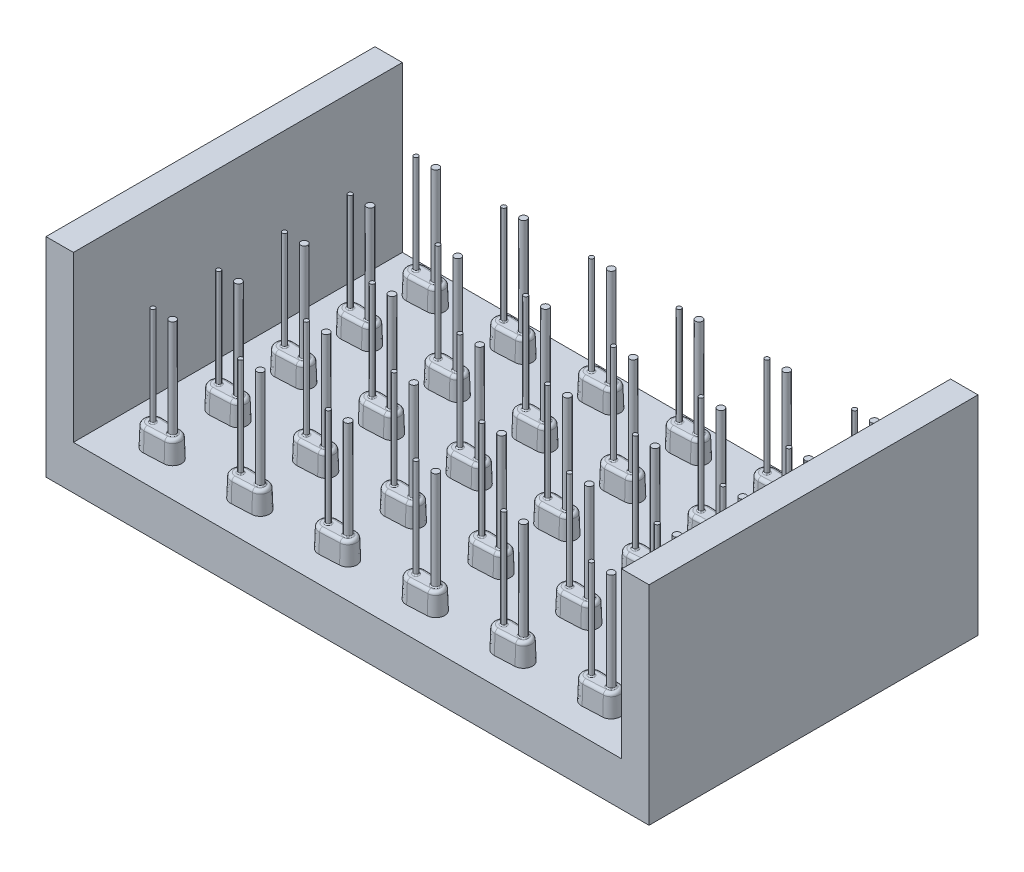
from build123d import *

# Parameters (mm, degrees)
SKETCH1_W                              = 55
SKETCH1_H                              = 30
BASE_DEPTH                             = 4
SKETCH2_W                              = 2.5
SKETCH2_H                              = 30
WALLS_DEPTH                            = 15
SCREW_POST_SKETCH_R                    = 0.2
SCREW_POST_DEPTH                       = 11
F_23_GA_POST_SLETCH_R                  = 0.315
F_23_GA_POST_DEPTH                     = 11
TOP_PIECE_PLASTIC_PART_DEPTH           = 2
TOP_PIECE_PLASTIC_PART_TAPER           = 2
TOP_PIECE_FILET_R                      = 0.3
POST_FILET_R                           = 0.1
TOP_PIECE_PATTERN_COUNT                = 5
TOP_PIECE_PATTERN_PITCH                = 6
TOP_PIECE_PATTERN_COUNT_DIR2           = 6
TOP_PIECE_PATTERN_PITCH_DIR2           = 8
TOP_PIECE_FILET_OF_TOP_PIECE_PATTERN_R = 0.3
POST_FILET_OF_TOP_PIECE_PATTERN_R      = 0.1
EXTRUDE1_DEPTH                         = 0.25


with BuildPart() as part:
    # Sketch1 → Base (new body)
    with BuildSketch(Plane(origin=(0, 0, 0), x_dir=(1, 0, 0), z_dir=(0, 1, 0))):
        Rectangle(SKETCH1_W, SKETCH1_H)
    extrude(amount=BASE_DEPTH)

    # Sketch2 → Walls (add)
    with BuildSketch(Plane(origin=(0, 4, 0), x_dir=(-1, 0, 0), z_dir=(0, 1, 0))):
        with Locations((26.25, 0)):
            Rectangle(SKETCH2_W, SKETCH2_H)
        with Locations((-26.25, 0)):
            Rectangle(SKETCH2_W, SKETCH2_H)
    extrude(amount=WALLS_DEPTH)

    # screw_post_sketch → screw_post (add)
    with BuildSketch(Plane(origin=(0, 4, 0), x_dir=(-1, 0, 0), z_dir=(0, 1, 0))):
        with Locations((21, 11.75)):
            Circle(SCREW_POST_SKETCH_R)
    screw_post = extrude(amount=SCREW_POST_DEPTH)

    # 23_Ga_post_sletch → 23_Ga_post (add)
    with BuildSketch(Plane(origin=(0, 4, 0), x_dir=(-1, 0, 0), z_dir=(0, 1, 0))):
        with Locations((19.2, 11.75)):
            Circle(F_23_GA_POST_SLETCH_R)
    f_23_ga_post = extrude(amount=F_23_GA_POST_DEPTH)

    # Sketch4 → Top_piece_plastic_part (add)
    with BuildSketch(Plane(origin=(0, 4, 0), x_dir=(-1, 0, 0), z_dir=(0, 1, 0))):
        with BuildLine():
            Line((20.9575, 12.648995968), (19.161513889, 12.564090793))
            ThreePointArc((19.161513889, 12.564090793), (18.385, 11.75), (19.161513889, 10.935909207))
            Line((19.161513889, 10.935909207), (20.9575, 10.851004032))
            ThreePointArc((20.9575, 10.851004032), (21.9, 11.75), (20.9575, 12.648995968))
        make_face()
    top_piece_plastic_part = extrude(amount=TOP_PIECE_PLASTIC_PART_DEPTH, taper=TOP_PIECE_PLASTIC_PART_TAPER)

    # Top_piece_filet
    top_piece_filet_edges = [part.edges().sort_by_distance(p)[0] for p in [
        (-18.454841539, 6, 11.75),
        (-20.062805017, 6, 10.963220244),
        (-21.830158461, 6, 11.75),
        (-20.062805017, 6, 12.536779756),
    ]]
    fillet(top_piece_filet_edges, radius=TOP_PIECE_FILET_R)

    # Post_filet
    post_filet_edges = [part.edges().sort_by_distance(p)[0] for p in [
        (-20.8, 6, 11.75),
        (-18.885, 6, 11.75),
    ]]
    fillet(post_filet_edges, radius=POST_FILET_R)

    # top_piece_pattern: screw_post, 23_Ga_post, Top_piece_plastic_part 5 × 6
    with Locations(*[(j * TOP_PIECE_PATTERN_PITCH_DIR2, 0, -i * TOP_PIECE_PATTERN_PITCH) for i in range(TOP_PIECE_PATTERN_COUNT) for j in range(TOP_PIECE_PATTERN_COUNT_DIR2) if (i, j) != (0, 0)]):
        add(screw_post)
        add(f_23_ga_post)
        add(top_piece_plastic_part)

    # Top_piece_filet of top_piece_pattern
    top_piece_filet_of_top_piece_pattern_edges = [part.edges().sort_by_distance(p)[0] for p in [
        (-10.454841539, 6, 11.75),
        (-12.062805017, 6, 10.963220244),
        (-13.830158461, 6, 11.75),
        (-12.062805017, 6, 12.536779756),
        (-2.454841539, 6, 11.75),
        (-4.062805017, 6, 10.963220244),
        (-5.830158461, 6, 11.75),
        (-4.062805017, 6, 12.536779756),
        (5.545158461, 6, 11.75),
        (3.937194983, 6, 10.963220244),
        (2.169841539, 6, 11.75),
        (3.937194983, 6, 12.536779756),
        (13.545158461, 6, 11.75),
        (11.937194983, 6, 10.963220244),
        (10.169841539, 6, 11.75),
        (11.937194983, 6, 12.536779756),
        (21.545158461, 6, 11.75),
        (19.937194983, 6, 10.963220244),
        (18.169841539, 6, 11.75),
        (19.937194983, 6, 12.536779756),
        (-18.454841539, 6, 5.75),
        (-20.062805017, 6, 4.963220244),
        (-21.830158461, 6, 5.75),
        (-20.062805017, 6, 6.536779756),
        (-10.454841539, 6, 5.75),
        (-12.062805017, 6, 4.963220244),
        (-13.830158461, 6, 5.75),
        (-12.062805017, 6, 6.536779756),
        (-2.454841539, 6, 5.75),
        (-4.062805017, 6, 4.963220244),
        (-5.830158461, 6, 5.75),
        (-4.062805017, 6, 6.536779756),
        (5.545158461, 6, 5.75),
        (3.937194983, 6, 4.963220244),
        (2.169841539, 6, 5.75),
        (3.937194983, 6, 6.536779756),
        (13.545158461, 6, 5.75),
        (11.937194983, 6, 4.963220244),
        (10.169841539, 6, 5.75),
        (11.937194983, 6, 6.536779756),
        (21.545158461, 6, 5.75),
        (19.937194983, 6, 4.963220244),
        (18.169841539, 6, 5.75),
        (19.937194983, 6, 6.536779756),
        (-18.454841539, 6, -0.25),
        (-20.062805017, 6, -1.036779756),
        (-21.830158461, 6, -0.25),
        (-20.062805017, 6, 0.536779756),
        (-10.454841539, 6, -0.25),
        (-12.062805017, 6, -1.036779756),
        (-13.830158461, 6, -0.25),
        (-12.062805017, 6, 0.536779756),
        (-2.454841539, 6, -0.25),
        (-4.062805017, 6, -1.036779756),
        (-5.830158461, 6, -0.25),
        (-4.062805017, 6, 0.536779756),
        (5.545158461, 6, -0.25),
        (3.937194983, 6, -1.036779756),
        (2.169841539, 6, -0.25),
        (3.937194983, 6, 0.536779756),
        (13.545158461, 6, -0.25),
        (11.937194983, 6, -1.036779756),
        (10.169841539, 6, -0.25),
        (11.937194983, 6, 0.536779756),
        (21.545158461, 6, -0.25),
        (19.937194983, 6, -1.036779756),
        (18.169841539, 6, -0.25),
        (19.937194983, 6, 0.536779756),
        (-18.454841539, 6, -6.25),
        (-20.062805017, 6, -7.036779756),
        (-21.830158461, 6, -6.25),
        (-20.062805017, 6, -5.463220244),
        (-10.454841539, 6, -6.25),
        (-12.062805017, 6, -7.036779756),
        (-13.830158461, 6, -6.25),
        (-12.062805017, 6, -5.463220244),
        (-2.454841539, 6, -6.25),
        (-4.062805017, 6, -7.036779756),
        (-5.830158461, 6, -6.25),
        (-4.062805017, 6, -5.463220244),
        (5.545158461, 6, -6.25),
        (3.937194983, 6, -7.036779756),
        (2.169841539, 6, -6.25),
        (3.937194983, 6, -5.463220244),
        (13.545158461, 6, -6.25),
        (11.937194983, 6, -7.036779756),
        (10.169841539, 6, -6.25),
        (11.937194983, 6, -5.463220244),
        (21.545158461, 6, -6.25),
        (19.937194983, 6, -7.036779756),
        (18.169841539, 6, -6.25),
        (19.937194983, 6, -5.463220244),
        (-18.454841539, 6, -12.25),
        (-20.062805017, 6, -13.036779756),
        (-21.830158461, 6, -12.25),
        (-20.062805017, 6, -11.463220244),
        (-10.454841539, 6, -12.25),
        (-12.062805017, 6, -13.036779756),
        (-13.830158461, 6, -12.25),
        (-12.062805017, 6, -11.463220244),
        (-2.454841539, 6, -12.25),
        (-4.062805017, 6, -13.036779756),
        (-5.830158461, 6, -12.25),
        (-4.062805017, 6, -11.463220244),
        (5.545158461, 6, -12.25),
        (3.937194983, 6, -13.036779756),
        (2.169841539, 6, -12.25),
        (3.937194983, 6, -11.463220244),
        (13.545158461, 6, -12.25),
        (11.937194983, 6, -13.036779756),
        (10.169841539, 6, -12.25),
        (11.937194983, 6, -11.463220244),
        (21.545158461, 6, -12.25),
        (19.937194983, 6, -13.036779756),
        (18.169841539, 6, -12.25),
        (19.937194983, 6, -11.463220244),
    ]]
    fillet(top_piece_filet_of_top_piece_pattern_edges, radius=TOP_PIECE_FILET_OF_TOP_PIECE_PATTERN_R)

    # Post_filet of top_piece_pattern
    post_filet_of_top_piece_pattern_edges = [part.edges().sort_by_distance(p)[0] for p in [
        (-12.8, 6, 11.75),
        (-10.885, 6, 11.75),
        (-4.8, 6, 11.75),
        (-2.885, 6, 11.75),
        (3.2, 6, 11.75),
        (5.115, 6, 11.75),
        (11.2, 6, 11.75),
        (13.115, 6, 11.75),
        (19.2, 6, 11.75),
        (21.115, 6, 11.75),
        (-20.8, 6, 5.75),
        (-18.885, 6, 5.75),
        (-12.8, 6, 5.75),
        (-10.885, 6, 5.75),
        (-4.8, 6, 5.75),
        (-2.885, 6, 5.75),
        (3.2, 6, 5.75),
        (5.115, 6, 5.75),
        (11.2, 6, 5.75),
        (13.115, 6, 5.75),
        (19.2, 6, 5.75),
        (21.115, 6, 5.75),
        (-20.8, 6, -0.25),
        (-18.885, 6, -0.25),
        (-12.8, 6, -0.25),
        (-10.885, 6, -0.25),
        (-4.8, 6, -0.25),
        (-2.885, 6, -0.25),
        (3.2, 6, -0.25),
        (5.115, 6, -0.25),
        (11.2, 6, -0.25),
        (13.115, 6, -0.25),
        (19.2, 6, -0.25),
        (21.115, 6, -0.25),
        (-20.8, 6, -6.25),
        (-18.885, 6, -6.25),
        (-12.8, 6, -6.25),
        (-10.885, 6, -6.25),
        (-4.8, 6, -6.25),
        (-2.885, 6, -6.25),
        (3.2, 6, -6.25),
        (5.115, 6, -6.25),
        (11.2, 6, -6.25),
        (13.115, 6, -6.25),
        (19.2, 6, -6.25),
        (21.115, 6, -6.25),
        (-20.8, 6, -12.25),
        (-18.885, 6, -12.25),
        (-12.8, 6, -12.25),
        (-10.885, 6, -12.25),
        (-4.8, 6, -12.25),
        (-2.885, 6, -12.25),
        (3.2, 6, -12.25),
        (5.115, 6, -12.25),
        (11.2, 6, -12.25),
        (13.115, 6, -12.25),
        (19.2, 6, -12.25),
        (21.115, 6, -12.25),
    ]]
    fillet(post_filet_of_top_piece_pattern_edges, radius=POST_FILET_OF_TOP_PIECE_PATTERN_R)

    # Sketch5 → Extrude1 (add)
    # profile 1 of 16: a face of its own
    with BuildSketch(Plane(origin=(0, 4, 0), x_dir=(-1, 0, 0), z_dir=(0, 1, 0))):
        Polygon((-22.960116624, -12.387319566), (-22.960116624, -12.117788316), (-23.665344989, -11.81850947), (-22.960116624, -11.487379663), (-22.960116624, -11.213641682), (-24.460116624, -11.918269086), (-24.460116624, -12.192007066), (-23.967027682, -11.960336393), align=None)
    # profile 2 of 16: a face of its own
    with BuildSketch(Plane(origin=(0, 4, 0), x_dir=(-1, 0, 0), z_dir=(0, 1, 0))):
        with BuildLine():
            Line((-22.960116624, -10.242487836), (-22.960116624, -9.973257066))
            Line((-22.960116624, -9.973257066), (-24.05627047, -9.973257066))
            Line((-24.05627047, -9.973257066), (-24.05627047, -10.242487836))
            Line((-24.05627047, -10.242487836), (-23.936679124, -10.242487836))
            add(Edge.make_bspline(
                [(-23.936679124, -10.242487836), (-23.94831865, -10.255828724), (-23.970908671, -10.281720752), (-24.000241938, -10.322508136), (-24.024310941, -10.363373505), (-24.04381057, -10.404501305), (-24.057816966, -10.446765525), (-24.068196379, -10.49026865), (-24.074251475, -10.535586778), (-24.075080312, -10.5663884), (-24.075501239, -10.582031105)],
                knots=[0, 0, 0, 0, 1.129160586, 2.191477711, 3.199794721, 4.151823543, 5.089502826, 6.035032201, 7.00208469, 8, 8, 8, 8], degree=3))
            add(Edge.make_bspline(
                [(-24.075501239, -10.582031105), (-24.075106168, -10.599591198), (-24.074325485, -10.634290938), (-24.066108369, -10.685209286), (-24.053528446, -10.734374725), (-24.035732838, -10.781753482), (-24.012649059, -10.827236261), (-23.985030533, -10.871192832), (-23.951455685, -10.912608296), (-23.914037143, -10.952379679), (-23.872589153, -10.988700322), (-23.828295021, -11.02089858), (-23.781128387, -11.04765544), (-23.731699603, -11.069649973), (-23.679889283, -11.086926094), (-23.625561279, -11.099247924), (-23.568688515, -11.106516265), (-23.529949309, -11.10741601), (-23.510296912, -11.107872451)],
                knots=[0, 0, 0, 0, 0.980545136, 1.937612761, 2.874348888, 3.813122963, 4.759326438, 5.720509799, 6.70829705, 7.733758992, 8.768951258, 9.783355028, 10.788637727, 11.793421666, 12.80232853, 13.835642703, 14.90202171, 16, 16, 16, 16], degree=3))
            add(Edge.make_bspline(
                [(-23.510296912, -11.107872451), (-23.489946717, -11.10739361), (-23.450027541, -11.10645431), (-23.391449532, -11.099578863), (-23.335768678, -11.087494299), (-23.282933948, -11.07097602), (-23.232797469, -11.049851918), (-23.185673571, -11.023597731), (-23.141139167, -10.992866982), (-23.100304214, -10.957356562), (-23.063025641, -10.919021801), (-23.030114863, -10.878257925), (-23.002842669, -10.835054132), (-22.979959939, -10.790095984), (-22.962612813, -10.742938288), (-22.949826664, -10.693864615), (-22.942173642, -10.642669744), (-22.941318682, -10.607798044), (-22.940885855, -10.590144086)],
                knots=[0, 0, 0, 0, 1.136421085, 2.229216585, 3.287981067, 4.314102594, 5.316702899, 6.320753391, 7.321604446, 8.333029371, 9.337827526, 10.304906535, 11.253050047, 12.186157492, 13.117149921, 14.053303955, 15.014476191, 16, 16, 16, 16], degree=3))
            add(Edge.make_bspline(
                [(-22.940885855, -10.590144086), (-22.941225602, -10.573790591), (-22.941897839, -10.54143292), (-22.949197051, -10.493871805), (-22.96023659, -10.447744384), (-22.975965946, -10.403302283), (-22.995827459, -10.360180974), (-23.020715414, -10.31912217), (-23.049583782, -10.279227673), (-23.07213059, -10.254885758), (-23.08361422, -10.242487836)],
                knots=[0, 0, 0, 0, 1.017011718, 2.012299608, 2.98747302, 3.965332399, 4.941441765, 5.936729654, 6.94912688, 8, 8, 8, 8], degree=3))
            Line((-23.08361422, -10.242487836), (-22.960116624, -10.242487836))
        make_face()
        with BuildLine():
            add(Edge.make_bspline(
                [(-23.190885855, -10.533653701), (-23.191215028, -10.544381754), (-23.191860187, -10.565408036), (-23.195740863, -10.596330062), (-23.202578787, -10.625882242), (-23.212680351, -10.653853813), (-23.224985528, -10.680661655), (-23.24039756, -10.705898685), (-23.258614254, -10.729773192), (-23.279194584, -10.752144769), (-23.30181613, -10.772539757), (-23.326501138, -10.790121428), (-23.352584487, -10.805063007), (-23.380144601, -10.8176997), (-23.409507601, -10.826744705), (-23.440291233, -10.833908345), (-23.472746984, -10.837625811), (-23.494864574, -10.83829967), (-23.506090182, -10.838641682)],
                knots=[0, 0, 0, 0, 1.04836806, 2.054732945, 3.03993516, 4.00574415, 4.955904794, 5.917688631, 6.888591924, 7.88601754, 8.884115178, 9.859153345, 10.841239365, 11.818093293, 12.814750328, 13.83810466, 14.90274714, 16, 16, 16, 16], degree=3))
            add(Edge.make_bspline(
                [(-23.506090182, -10.838641682), (-23.517417699, -10.838305046), (-23.53973844, -10.837641708), (-23.57246673, -10.833846525), (-23.603704507, -10.826948471), (-23.633172951, -10.81684486), (-23.661411438, -10.804623664), (-23.687885089, -10.789231272), (-23.712681695, -10.770907645), (-23.73602257, -10.750482703), (-23.756720113, -10.727654725), (-23.775551719, -10.703874807), (-23.790623933, -10.678210024), (-23.803504345, -10.651546419), (-23.813397142, -10.623641256), (-23.820337694, -10.594324665), (-23.824585019, -10.563826234), (-23.825193724, -10.542982146), (-23.825501239, -10.532451778)],
                knots=[0, 0, 0, 0, 1.099386164, 2.166327687, 3.192099357, 4.19717067, 5.185034887, 6.173616074, 7.161193358, 8.17338296, 9.177655011, 10.147763629, 11.111227589, 12.058972978, 13.018112925, 13.97759754, 14.978288615, 16, 16, 16, 16], degree=3))
            add(Edge.make_bspline(
                [(-23.825501239, -10.532451778), (-23.825170211, -10.521523912), (-23.824521214, -10.500099355), (-23.820676089, -10.468672719), (-23.813812602, -10.438724032), (-23.80365499, -10.410375031), (-23.791431551, -10.38320326), (-23.776345287, -10.357414898), (-23.7580319, -10.333378209), (-23.737612506, -10.310525608), (-23.714346288, -10.290341118), (-23.689778118, -10.272010191), (-23.663046638, -10.256985645), (-23.634737921, -10.244659567), (-23.604747023, -10.234999842), (-23.573070052, -10.228032166), (-23.539635189, -10.224250699), (-23.516816064, -10.223592465), (-23.505188739, -10.223257066)],
                knots=[0, 0, 0, 0, 1.049905731, 2.058385982, 3.036337956, 3.994927362, 4.946537361, 5.895419282, 6.857623746, 7.845325573, 8.833777008, 9.811444928, 10.78531754, 11.772081556, 12.77319045, 13.807459548, 14.882806445, 16, 16, 16, 16], degree=3))
            add(Edge.make_bspline(
                [(-23.505188739, -10.223257066), (-23.493761402, -10.223588297), (-23.471440494, -10.224235287), (-23.438703698, -10.228048541), (-23.407648905, -10.235065473), (-23.378180908, -10.244525929), (-23.350550528, -10.257065431), (-23.324458305, -10.272107621), (-23.300236965, -10.290239644), (-23.277563983, -10.310645787), (-23.257430739, -10.33336744), (-23.239356277, -10.35754778), (-23.224484206, -10.383462757), (-23.211887671, -10.410623094), (-23.202769683, -10.439464789), (-23.195684614, -10.469460851), (-23.191862901, -10.50110462), (-23.191216852, -10.522626953), (-23.190885855, -10.533653701)],
                knots=[0, 0, 0, 0, 1.106469885, 2.16125711, 3.184599668, 4.184238692, 5.152050012, 6.116650044, 7.094080022, 8.075733422, 9.064591803, 10.028460505, 10.993060537, 11.952039452, 12.921015874, 13.915988178, 14.932277727, 16, 16, 16, 16], degree=3))
        make_face(mode=Mode.SUBTRACT)
    # profile 3 of 16: a face of its own
    with BuildSketch(Plane(origin=(0, 4, 0), x_dir=(-1, 0, 0), z_dir=(0, 1, 0))):
        with BuildLine():
            Line((-22.960116624, -9.704026297), (-22.960116624, -9.434795528))
            Line((-22.960116624, -9.434795528), (-23.091126239, -9.434795528))
            add(Edge.make_bspline(
                [(-23.091126239, -9.434795528), (-23.07904385, -9.42281764), (-23.055254617, -9.399234163), (-23.024550491, -9.360131384), (-22.998567744, -9.319156486), (-22.977369016, -9.276255322), (-22.96107878, -9.23138539), (-22.949295895, -9.184593251), (-22.942292372, -9.135628077), (-22.941359891, -9.102286115), (-22.940885855, -9.085336393)],
                knots=[0, 0, 0, 0, 1.041604913, 2.050834463, 3.038316637, 4.009881179, 4.976705026, 5.957567047, 6.961708705, 8, 8, 8, 8], degree=3))
            add(Edge.make_bspline(
                [(-22.940885855, -9.085336393), (-22.941421192, -9.068365396), (-22.942474987, -9.034958536), (-22.952069763, -8.986204056), (-22.967801063, -8.939986821), (-22.989794807, -8.896724725), (-23.017596673, -8.856578171), (-23.051616624, -8.820800146), (-23.091084423, -8.78860082), (-23.120903733, -8.771428105), (-23.136198355, -8.762620047)],
                knots=[0, 0, 0, 0, 1.023911673, 2.015537006, 2.987151534, 3.96359182, 4.936711095, 5.925066441, 6.935745846, 8, 8, 8, 8], degree=3))
            add(Edge.make_bspline(
                [(-23.136198355, -8.762620047), (-23.120859283, -8.751276152), (-23.090752991, -8.729011268), (-23.051468271, -8.689531379), (-23.017366504, -8.646825887), (-22.989946338, -8.599959903), (-22.967701804, -8.550582716), (-22.952160372, -8.498551943), (-22.942482586, -8.44437239), (-22.94142252, -8.407492607), (-22.940885855, -8.38882197)],
                knots=[0, 0, 0, 0, 1.041229049, 2.043640428, 3.033525965, 4.020091993, 5.002641512, 5.986151007, 6.980475447, 8, 8, 8, 8], degree=3))
            add(Edge.make_bspline(
                [(-22.940885855, -8.38882197), (-22.941463069, -8.369641955), (-22.942592959, -8.332097334), (-22.953120108, -8.27772932), (-22.969926379, -8.226757779), (-22.99374217, -8.180248203), (-23.022360884, -8.138249874), (-23.056029293, -8.102494043), (-23.093716912, -8.072827769), (-23.128903336, -8.053509569), (-23.160013135, -8.041021224), (-23.18708434, -8.033480597), (-23.217312811, -8.026427796), (-23.251104804, -8.021361059), (-23.288142719, -8.016631486), (-23.32867279, -8.013885783), (-23.372558484, -8.0120195), (-23.402922756, -8.011821277), (-23.418650278, -8.011718605)],
                knots=[0, 0, 0, 0, 1.315170088, 2.574427765, 3.785264002, 4.987326231, 6.148597475, 7.262257941, 8.344498924, 9.427503778, 10.004496072, 10.641882744, 11.353963707, 12.133766957, 12.985572148, 13.916147416, 14.920644765, 16, 16, 16, 16], degree=3))
            Line((-23.418650278, -8.011718605), (-24.05627047, -8.011718605))
            Line((-24.05627047, -8.011718605), (-24.05627047, -8.280949374))
            Line((-24.05627047, -8.280949374), (-23.505789701, -8.280949374))
            add(Edge.make_bspline(
                [(-23.505789701, -8.280949374), (-23.49106532, -8.281173361), (-23.462803202, -8.281603282), (-23.422267277, -8.283433111), (-23.385502302, -8.287522005), (-23.352315011, -8.292333185), (-23.322848053, -8.299155303), (-23.297175004, -8.307650519), (-23.274883723, -8.31691018), (-23.256469355, -8.328714723), (-23.240877802, -8.341820338), (-23.227546585, -8.356443092), (-23.216037199, -8.372411336), (-23.206592258, -8.389937908), (-23.199733005, -8.409242258), (-23.194772176, -8.429897265), (-23.191190277, -8.452001502), (-23.190989197, -8.467232287), (-23.190885855, -8.475059951)],
                knots=[0, 0, 0, 0, 1.668542725, 3.202616995, 4.59494355, 5.858072538, 7.000420988, 8.016011705, 8.920533432, 9.726500161, 10.483524044, 11.222469706, 11.962547318, 12.70886311, 13.469958868, 14.276404817, 15.114180646, 16, 16, 16, 16], degree=3))
            add(Edge.make_bspline(
                [(-23.190885855, -8.475059951), (-23.191302813, -8.487120327), (-23.192121011, -8.510786414), (-23.199939809, -8.545272726), (-23.212722706, -8.5777246), (-23.230112706, -8.608020457), (-23.251832488, -8.635508399), (-23.277594219, -8.65955339), (-23.307546368, -8.679411198), (-23.335335955, -8.693157258), (-23.360463325, -8.701746818), (-23.381982899, -8.707805973), (-23.406318355, -8.712528842), (-23.43322323, -8.716225467), (-23.46284962, -8.719771946), (-23.495160062, -8.721511829), (-23.530109668, -8.72329226), (-23.554264343, -8.723269083), (-23.566787297, -8.723257066)],
                knots=[0, 0, 0, 0, 1.129913425, 2.217230253, 3.297175357, 4.391411011, 5.481605898, 6.571841268, 7.681894157, 8.841607612, 9.468549532, 10.170608623, 10.93710061, 11.791434153, 12.717934886, 13.734733707, 14.825576123, 16, 16, 16, 16], degree=3))
            Line((-23.566787297, -8.723257066), (-24.05627047, -8.723257066))
            Line((-24.05627047, -8.723257066), (-24.05627047, -8.992487836))
            Line((-24.05627047, -8.992487836), (-23.530729605, -8.992487836))
            add(Edge.make_bspline(
                [(-23.530729605, -8.992487836), (-23.519008403, -8.992495439), (-23.496460607, -8.992510066), (-23.463921869, -8.994015816), (-23.433813836, -8.995073521), (-23.406212929, -8.998135962), (-23.380989871, -9.000798426), (-23.358359122, -9.00482941), (-23.338263085, -9.009192378), (-23.31522668, -9.015909117), (-23.289821492, -9.026289994), (-23.263192372, -9.042004826), (-23.240374891, -9.060129737), (-23.222053054, -9.081469809), (-23.208251267, -9.105669715), (-23.197767935, -9.131890176), (-23.192177093, -9.160725884), (-23.19132535, -9.180567136), (-23.190885855, -9.190805143)],
                knots=[0, 0, 0, 0, 1.256080007, 2.416291064, 3.491165587, 4.483530984, 5.391666676, 6.208822394, 6.945895165, 7.594739348, 8.778939682, 9.876256816, 10.898991119, 11.88874005, 12.870128133, 13.872891123, 14.902420331, 16, 16, 16, 16], degree=3))
            add(Edge.make_bspline(
                [(-23.190885855, -9.190805143), (-23.19128221, -9.202372382), (-23.192067195, -9.225281394), (-23.20034351, -9.258588343), (-23.213044752, -9.290331127), (-23.230805006, -9.320036488), (-23.253176753, -9.347059455), (-23.279361761, -9.371235606), (-23.310377615, -9.390645498), (-23.338939968, -9.404235175), (-23.364478426, -9.41340553), (-23.386777151, -9.418908099), (-23.41148948, -9.424143793), (-23.43894062, -9.427729964), (-23.468857719, -9.431319184), (-23.501470968, -9.433046874), (-23.536720223, -9.434831254), (-23.561075203, -9.434807723), (-23.573698355, -9.434795528)],
                knots=[0, 0, 0, 0, 1.079272053, 2.137507324, 3.187593888, 4.26658165, 5.357445865, 6.457671147, 7.582166706, 8.763159278, 9.408686215, 10.114907681, 10.908114626, 11.768737996, 12.701314335, 13.723912485, 14.820306998, 16, 16, 16, 16], degree=3))
            Line((-23.573698355, -9.434795528), (-24.05627047, -9.434795528))
            Line((-24.05627047, -9.434795528), (-24.05627047, -9.704026297))
            Line((-24.05627047, -9.704026297), (-22.960116624, -9.704026297))
        make_face()
    # profile 4 of 16: a face of its own
    with BuildSketch(Plane(origin=(0, 4, 0), x_dir=(-1, 0, 0), z_dir=(0, 1, 0))):
        with BuildLine():
            Line((-22.960116624, -6.915564759), (-22.960116624, -6.646333989))
            Line((-22.960116624, -6.646333989), (-24.05627047, -6.646333989))
            Line((-24.05627047, -6.646333989), (-24.05627047, -6.915564759))
            Line((-24.05627047, -6.915564759), (-23.936679124, -6.915564759))
            add(Edge.make_bspline(
                [(-23.936679124, -6.915564759), (-23.94831865, -6.928905647), (-23.970908671, -6.954797676), (-24.000241938, -6.995585059), (-24.024310941, -7.036450428), (-24.04381057, -7.077578228), (-24.057816966, -7.119842448), (-24.068196379, -7.163345573), (-24.074251475, -7.208663701), (-24.075080312, -7.239465323), (-24.075501239, -7.255108028)],
                knots=[0, 0, 0, 0, 1.129160586, 2.191477711, 3.199794721, 4.151823543, 5.089502826, 6.035032201, 7.00208469, 8, 8, 8, 8], degree=3))
            add(Edge.make_bspline(
                [(-24.075501239, -7.255108028), (-24.075106168, -7.272668121), (-24.074325485, -7.307367862), (-24.066108369, -7.358286209), (-24.053528446, -7.407451648), (-24.035732838, -7.454830405), (-24.012649059, -7.500313184), (-23.985030533, -7.544269755), (-23.951455685, -7.585685219), (-23.914037143, -7.625456602), (-23.872589153, -7.661777245), (-23.828295021, -7.693975503), (-23.781128387, -7.720732363), (-23.731699603, -7.742726896), (-23.679889283, -7.760003017), (-23.625561279, -7.772324847), (-23.568688515, -7.779593189), (-23.529949309, -7.780492934), (-23.510296912, -7.780949374)],
                knots=[0, 0, 0, 0, 0.980545136, 1.937612761, 2.874348888, 3.813122963, 4.759326438, 5.720509799, 6.70829705, 7.733758992, 8.768951258, 9.783355028, 10.788637727, 11.793421666, 12.80232853, 13.835642703, 14.90202171, 16, 16, 16, 16], degree=3))
            add(Edge.make_bspline(
                [(-23.510296912, -7.780949374), (-23.489946717, -7.780470533), (-23.450027541, -7.779531233), (-23.391449532, -7.772655786), (-23.335768678, -7.760571222), (-23.282933948, -7.744052943), (-23.232797469, -7.722928841), (-23.185673571, -7.696674654), (-23.141139167, -7.665943905), (-23.100304214, -7.630433485), (-23.063025641, -7.592098724), (-23.030114863, -7.551334848), (-23.002842669, -7.508131055), (-22.979959939, -7.463172907), (-22.962612813, -7.416015211), (-22.949826664, -7.366941538), (-22.942173642, -7.315746667), (-22.941318682, -7.280874967), (-22.940885855, -7.263221009)],
                knots=[0, 0, 0, 0, 1.136421085, 2.229216585, 3.287981067, 4.314102594, 5.316702899, 6.320753391, 7.321604446, 8.333029371, 9.337827526, 10.304906535, 11.253050047, 12.186157492, 13.117149921, 14.053303955, 15.014476191, 16, 16, 16, 16], degree=3))
            add(Edge.make_bspline(
                [(-22.940885855, -7.263221009), (-22.941225602, -7.246867514), (-22.941897839, -7.214509843), (-22.949197051, -7.166948728), (-22.96023659, -7.120821307), (-22.975965946, -7.076379206), (-22.995827459, -7.033257897), (-23.020715414, -6.992199093), (-23.049583782, -6.952304596), (-23.07213059, -6.927962681), (-23.08361422, -6.915564759)],
                knots=[0, 0, 0, 0, 1.017011718, 2.012299608, 2.98747302, 3.965332399, 4.941441765, 5.936729654, 6.94912688, 8, 8, 8, 8], degree=3))
            Line((-23.08361422, -6.915564759), (-22.960116624, -6.915564759))
        make_face()
        with BuildLine():
            add(Edge.make_bspline(
                [(-23.190885855, -7.206730624), (-23.191215028, -7.217458677), (-23.191860187, -7.238484959), (-23.195740863, -7.269406985), (-23.202578787, -7.298959165), (-23.212680351, -7.326930737), (-23.224985528, -7.353738578), (-23.24039756, -7.378975608), (-23.258614254, -7.402850115), (-23.279194584, -7.425221692), (-23.30181613, -7.44561668), (-23.326501138, -7.463198351), (-23.352584487, -7.47813993), (-23.380144601, -7.490776623), (-23.409507601, -7.499821628), (-23.440291233, -7.506985268), (-23.472746984, -7.510702734), (-23.494864574, -7.511376593), (-23.506090182, -7.511718605)],
                knots=[0, 0, 0, 0, 1.04836806, 2.054732945, 3.03993516, 4.00574415, 4.955904794, 5.917688631, 6.888591924, 7.88601754, 8.884115178, 9.859153345, 10.841239365, 11.818093293, 12.814750328, 13.83810466, 14.90274714, 16, 16, 16, 16], degree=3))
            add(Edge.make_bspline(
                [(-23.506090182, -7.511718605), (-23.517417699, -7.511381969), (-23.53973844, -7.510718631), (-23.57246673, -7.506923448), (-23.603704507, -7.500025394), (-23.633172951, -7.489921783), (-23.661411438, -7.477700587), (-23.687885089, -7.462308195), (-23.712681695, -7.443984568), (-23.73602257, -7.423559626), (-23.756720113, -7.400731648), (-23.775551719, -7.37695173), (-23.790623933, -7.351286947), (-23.803504345, -7.324623342), (-23.813397142, -7.296718179), (-23.820337694, -7.267401588), (-23.824585019, -7.236903157), (-23.825193724, -7.216059069), (-23.825501239, -7.205528701)],
                knots=[0, 0, 0, 0, 1.099386164, 2.166327687, 3.192099357, 4.19717067, 5.185034887, 6.173616074, 7.161193358, 8.17338296, 9.177655011, 10.147763629, 11.111227589, 12.058972978, 13.018112925, 13.97759754, 14.978288615, 16, 16, 16, 16], degree=3))
            add(Edge.make_bspline(
                [(-23.825501239, -7.205528701), (-23.825170211, -7.194600835), (-23.824521214, -7.173176278), (-23.820676089, -7.141749642), (-23.813812602, -7.111800955), (-23.80365499, -7.083451954), (-23.791431551, -7.056280183), (-23.776345287, -7.030491821), (-23.7580319, -7.006455132), (-23.737612506, -6.983602531), (-23.714346288, -6.963418041), (-23.689778118, -6.945087114), (-23.663046638, -6.930062568), (-23.634737921, -6.91773649), (-23.604747023, -6.908076765), (-23.573070052, -6.901109089), (-23.539635189, -6.897327622), (-23.516816064, -6.896669388), (-23.505188739, -6.896333989)],
                knots=[0, 0, 0, 0, 1.049905731, 2.058385982, 3.036337956, 3.994927362, 4.946537361, 5.895419282, 6.857623746, 7.845325573, 8.833777008, 9.811444928, 10.78531754, 11.772081556, 12.77319045, 13.807459548, 14.882806445, 16, 16, 16, 16], degree=3))
            add(Edge.make_bspline(
                [(-23.505188739, -6.896333989), (-23.493761402, -6.89666522), (-23.471440494, -6.89731221), (-23.438703698, -6.901125465), (-23.407648905, -6.908142396), (-23.378180908, -6.917602852), (-23.350550528, -6.930142354), (-23.324458305, -6.945184544), (-23.300236965, -6.963316567), (-23.277563983, -6.98372271), (-23.257430739, -7.006444363), (-23.239356277, -7.030624703), (-23.224484206, -7.05653968), (-23.211887671, -7.083700017), (-23.202769683, -7.112541712), (-23.195684614, -7.142537774), (-23.191862901, -7.174181543), (-23.191216852, -7.195703876), (-23.190885855, -7.206730624)],
                knots=[0, 0, 0, 0, 1.106469885, 2.16125711, 3.184599668, 4.184238692, 5.152050012, 6.116650044, 7.094080022, 8.075733422, 9.064591803, 10.028460505, 10.993060537, 11.952039452, 12.921015874, 13.915988178, 14.932277727, 16, 16, 16, 16], degree=3))
        make_face(mode=Mode.SUBTRACT)
    # profile 5 of 16: a face of its own
    with BuildSketch(Plane(origin=(0, 4, 0), x_dir=(-1, 0, 0), z_dir=(0, 1, 0))):
        with BuildLine():
            add(Edge.make_bspline(
                [(-22.498578162, -6.243990239), (-22.499178509, -6.232296137), (-22.500355774, -6.209364292), (-22.510782969, -6.176322062), (-22.527894383, -6.146140702), (-22.551448541, -6.119647708), (-22.579361001, -6.097492466), (-22.610967384, -6.081213442), (-22.645520931, -6.071259853), (-22.669585724, -6.070035816), (-22.681871432, -6.069410913)],
                knots=[0, 0, 0, 0, 0.995917091, 1.952968814, 2.925129525, 3.936622411, 4.959141538, 5.949209871, 6.953017853, 8, 8, 8, 8], degree=3))
            add(Edge.make_bspline(
                [(-22.681871432, -6.069410913), (-22.693945244, -6.070078947), (-22.717662821, -6.071391222), (-22.751958917, -6.080799929), (-22.783118308, -6.097345714), (-22.811197037, -6.119002445), (-22.834421476, -6.145338114), (-22.851404386, -6.174977218), (-22.862246592, -6.207093692), (-22.863385347, -6.22958217), (-22.863962778, -6.240985432)],
                knots=[0, 0, 0, 0, 1.043811526, 2.050444424, 3.046135335, 4.077072307, 5.102170297, 6.060538231, 7.01655453, 8, 8, 8, 8], degree=3))
            add(Edge.make_bspline(
                [(-22.863962778, -6.240985432), (-22.863388372, -6.252686205), (-22.862260504, -6.275661136), (-22.851424259, -6.308682307), (-22.83402028, -6.338834813), (-22.810168705, -6.365468978), (-22.781553282, -6.387407042), (-22.749671302, -6.404165966), (-22.714452168, -6.413633267), (-22.690139202, -6.414909797), (-22.677664701, -6.415564759)],
                knots=[0, 0, 0, 0, 0.987521098, 1.939036667, 2.90720245, 3.915774129, 4.943044906, 5.943716191, 6.944961543, 8, 8, 8, 8], degree=3))
            add(Edge.make_bspline(
                [(-22.677664701, -6.415564759), (-22.665672408, -6.415072964), (-22.64217581, -6.414109388), (-22.608609992, -6.403982044), (-22.577763759, -6.388041406), (-22.550658739, -6.366123755), (-22.527202703, -6.340464192), (-22.510913269, -6.310601692), (-22.500283741, -6.278254235), (-22.499155791, -6.255594428), (-22.498578162, -6.243990239)],
                knots=[0, 0, 0, 0, 1.041915136, 2.041432787, 3.024826891, 4.049503271, 5.063162711, 6.031776888, 6.992064092, 8, 8, 8, 8], degree=3))
        make_face()
    # profile 6 of 16: a face of its own
    with BuildSketch(Plane(origin=(0, 4, 0), x_dir=(-1, 0, 0), z_dir=(0, 1, 0))):
        with BuildLine():
            Line((-22.960116624, -6.37710322), (-22.960116624, -6.107872451))
            Line((-22.960116624, -6.107872451), (-24.088121432, -6.107872451))
            add(Edge.make_bspline(
                [(-24.088121432, -6.107872451), (-24.100641581, -6.108040392), (-24.124885937, -6.108365597), (-24.160073908, -6.109366313), (-24.19283671, -6.111854299), (-24.223118657, -6.115053624), (-24.250985909, -6.119293485), (-24.276389164, -6.124267683), (-24.299379982, -6.13027029), (-24.326300633, -6.139279174), (-24.35649209, -6.153572132), (-24.388447931, -6.17548824), (-24.41614233, -6.201551834), (-24.43928021, -6.231963754), (-24.457174022, -6.266379195), (-24.470341004, -6.3041913), (-24.477725554, -6.345366885), (-24.478796744, -6.373869566), (-24.479347393, -6.388521489)],
                knots=[0, 0, 0, 0, 1.087870751, 2.106582289, 3.057635424, 3.94171963, 4.751506351, 5.505811896, 6.189668978, 6.814326215, 7.970363273, 9.078235859, 10.167775872, 11.260750684, 12.381770831, 13.52383714, 14.727117991, 16, 16, 16, 16], degree=3))
            add(Edge.make_bspline(
                [(-24.479347393, -6.388521489), (-24.478740146, -6.402773352), (-24.477445303, -6.433162854), (-24.469001919, -6.480873679), (-24.45607648, -6.533517594), (-24.443971871, -6.569593428), (-24.437580566, -6.588641682)],
                knots=[0, 0, 0, 0, 0.833128526, 1.776494837, 2.825976084, 4, 4, 4, 4], degree=3))
            Line((-24.437580566, -6.588641682), (-24.217628643, -6.588641682))
            add(Edge.make_bspline(
                [(-24.217628643, -6.588641682), (-24.222357719, -6.578613152), (-24.231374209, -6.559492685), (-24.240795137, -6.530822164), (-24.247583482, -6.504121944), (-24.24825568, -6.486715745), (-24.248578162, -6.478365239)],
                knots=[0, 0, 0, 0, 1.150954616, 2.194418511, 3.133784617, 4, 4, 4, 4], degree=3))
            add(Edge.make_bspline(
                [(-24.248578162, -6.478365239), (-24.248342145, -6.470402883), (-24.247894976, -6.455317076), (-24.241586068, -6.434345311), (-24.231874273, -6.416330772), (-24.217781284, -6.401121701), (-24.197908858, -6.389661951), (-24.171982752, -6.382391993), (-24.139976314, -6.377673393), (-24.116487968, -6.377303742), (-24.103746432, -6.37710322)],
                knots=[0, 0, 0, 0, 0.936804389, 1.774907915, 2.5581683, 3.336145098, 4.189867573, 5.229593264, 6.497159496, 8, 8, 8, 8], degree=3))
            Line((-24.103746432, -6.37710322), (-22.960116624, -6.37710322))
        make_face()
    # profile 7 of 16: a face of its own
    with BuildSketch(Plane(origin=(0, 4, 0), x_dir=(-1, 0, 0), z_dir=(0, 1, 0))):
        with BuildLine():
            Line((-22.960116624, -5.838641682), (-22.960116624, -5.569410913))
            Line((-22.960116624, -5.569410913), (-23.486258451, -5.569410913))
            add(Edge.make_bspline(
                [(-23.486258451, -5.569410913), (-23.498579422, -5.569387005), (-23.522226376, -5.56934112), (-23.55618803, -5.568064291), (-23.587244409, -5.566272648), (-23.615432127, -5.564036795), (-23.640683409, -5.560699659), (-23.662949962, -5.55684702), (-23.682392498, -5.552479543), (-23.704062975, -5.54537676), (-23.727782053, -5.534268444), (-23.752941747, -5.517474933), (-23.774830213, -5.497142322), (-23.793193161, -5.473289037), (-23.80784828, -5.44623946), (-23.817868198, -5.416121628), (-23.824465824, -5.383197125), (-23.825147005, -5.360210701), (-23.825501239, -5.348257066)],
                knots=[0, 0, 0, 0, 1.267467482, 2.432579623, 3.495718977, 4.46782216, 5.340771086, 6.114964255, 6.792308577, 7.388622481, 8.458084915, 9.475498183, 10.488937983, 11.51740562, 12.559360757, 13.637967653, 14.771671862, 16, 16, 16, 16], degree=3))
            add(Edge.make_bspline(
                [(-23.825501239, -5.348257066), (-23.8251007, -5.336313113), (-23.8243278, -5.313265456), (-23.818300519, -5.280040465), (-23.807972571, -5.249721714), (-23.793963929, -5.221997807), (-23.775215748, -5.197686326), (-23.75287596, -5.176519314), (-23.726584197, -5.158697187), (-23.706971295, -5.150132833), (-23.69689547, -5.145733028)],
                knots=[0, 0, 0, 0, 1.116871431, 2.155171802, 3.144773418, 4.104381479, 5.046960687, 6.001340237, 6.973219418, 8, 8, 8, 8], degree=3))
            add(Edge.make_bspline(
                [(-23.69689547, -5.145733028), (-23.692419837, -5.144117095), (-23.682540392, -5.14055011), (-23.665493629, -5.137405742), (-23.645417629, -5.133858157), (-23.621789922, -5.131788344), (-23.594962142, -5.129575095), (-23.564696004, -5.128154244), (-23.53113606, -5.12725293), (-23.507593328, -5.127154652), (-23.495272874, -5.12710322)],
                knots=[0, 0, 0, 0, 0.56097549, 1.238288705, 2.041265676, 2.968564175, 4.036154886, 5.220272437, 6.545304513, 8, 8, 8, 8], degree=3))
            Line((-23.495272874, -5.12710322), (-22.960116624, -5.12710322))
            Line((-22.960116624, -5.12710322), (-22.960116624, -4.857872451))
            Line((-22.960116624, -4.857872451), (-23.420753643, -4.857872451))
            add(Edge.make_bspline(
                [(-23.420753643, -4.857872451), (-23.443593526, -4.857914183), (-23.487384494, -4.857994195), (-23.550192945, -4.860619635), (-23.607336726, -4.863944603), (-23.658825217, -4.869174332), (-23.704944381, -4.875104214), (-23.745319233, -4.883295551), (-23.780364519, -4.892174065), (-23.801126271, -4.900347122), (-23.810777682, -4.904146489)],
                knots=[0, 0, 0, 0, 1.388116509, 2.661439483, 3.820463473, 4.866642689, 5.806839029, 6.644994921, 7.370105668, 8, 8, 8, 8], degree=3))
            add(Edge.make_bspline(
                [(-23.810777682, -4.904146489), (-23.821166255, -4.909013784), (-23.841672405, -4.918621405), (-23.87081992, -4.935300909), (-23.898464716, -4.953249634), (-23.923762601, -4.973430958), (-23.947602759, -4.994966162), (-23.969421594, -5.018281025), (-23.989258204, -5.043404104), (-24.007597431, -5.069908294), (-24.02324819, -5.098580813), (-24.037716634, -5.128688174), (-24.049233826, -5.16098488), (-24.058887326, -5.195012575), (-24.066368602, -5.230962248), (-24.071787373, -5.268688867), (-24.074689027, -5.308348034), (-24.075226066, -5.335332124), (-24.075501239, -5.349158509)],
                knots=[0, 0, 0, 0, 0.997222436, 1.96843142, 2.917797601, 3.860467999, 4.779133207, 5.709613475, 6.633219993, 7.560883278, 8.508369802, 9.470751391, 10.462672762, 11.485580885, 12.544670258, 13.653244457, 14.797545346, 16, 16, 16, 16], degree=3))
            add(Edge.make_bspline(
                [(-24.075501239, -5.349158509), (-24.075323242, -5.36409444), (-24.074974963, -5.393318993), (-24.070709903, -5.436015656), (-24.06519147, -5.47670615), (-24.055809123, -5.514936169), (-24.044939205, -5.551239611), (-24.031066297, -5.585199693), (-24.014755689, -5.616955184), (-23.996104078, -5.646568569), (-23.974940543, -5.673810175), (-23.952179897, -5.69928575), (-23.926916567, -5.722172834), (-23.899930694, -5.743218597), (-23.870973915, -5.762188156), (-23.84014919, -5.779090926), (-23.807316314, -5.793941225), (-23.784305156, -5.801864597), (-23.772616624, -5.805889278)],
                knots=[0, 0, 0, 0, 1.211240017, 2.369985978, 3.478996442, 4.539426614, 5.559871561, 6.551301256, 7.510778031, 8.453136967, 9.386094087, 10.30661716, 11.221130616, 12.147659962, 13.080758632, 14.026335491, 14.997475882, 16, 16, 16, 16], degree=3))
            add(Edge.make_bspline(
                [(-23.772616624, -5.805889278), (-23.763538862, -5.808635047), (-23.743983248, -5.814550073), (-23.7114841, -5.820936489), (-23.674027011, -5.826044577), (-23.631575139, -5.831013563), (-23.584057312, -5.834480019), (-23.531548994, -5.836745735), (-23.473947507, -5.83827661), (-23.433875697, -5.838516406), (-23.412941143, -5.838641682)],
                knots=[0, 0, 0, 0, 0.627914866, 1.352675004, 2.190563461, 3.132055958, 4.183353232, 5.345633452, 6.613289997, 8, 8, 8, 8], degree=3))
            Line((-23.412941143, -5.838641682), (-22.960116624, -5.838641682))
        make_face()
    # profile 8 of 16: a face of its own
    with BuildSketch(Plane(origin=(0, 4, 0), x_dir=(-1, 0, 0), z_dir=(0, 1, 0))):
        with BuildLine():
            Line((-22.960116624, -4.588641682), (-22.960116624, -4.319410913))
            Line((-22.960116624, -4.319410913), (-23.076102201, -4.319410913))
            add(Edge.make_bspline(
                [(-23.076102201, -4.319410913), (-23.064155279, -4.304051431), (-23.04132239, -4.274696475), (-23.01221034, -4.230071874), (-22.988383296, -4.187951775), (-22.970259227, -4.147397277), (-22.957219739, -4.107645346), (-22.947851645, -4.06805217), (-22.941852996, -4.028028127), (-22.941208062, -4.001122255), (-22.940885855, -3.987680143)],
                knots=[0, 0, 0, 0, 1.276643801, 2.439914479, 3.493451431, 4.44993799, 5.350072675, 6.235028322, 7.118224225, 8, 8, 8, 8], degree=3))
            add(Edge.make_bspline(
                [(-22.940885855, -3.987680143), (-22.941254071, -3.97404493), (-22.941976911, -3.947277861), (-22.947032591, -3.907864827), (-22.956240584, -3.870209501), (-22.96846631, -3.833888479), (-22.984603566, -3.799271447), (-23.00376394, -3.765934327), (-23.027102572, -3.734593186), (-23.044876153, -3.715291924), (-23.053866624, -3.705528701)],
                knots=[0, 0, 0, 0, 1.048836932, 2.058954983, 3.049370783, 4.026390553, 5.001981509, 5.982488534, 6.97947532, 8, 8, 8, 8], degree=3))
            add(Edge.make_bspline(
                [(-23.053866624, -3.705528701), (-23.062198162, -3.697698237), (-23.078922214, -3.681979999), (-23.10754135, -3.662200571), (-23.138741448, -3.645227597), (-23.172882409, -3.631320604), (-23.210151817, -3.621043896), (-23.25009951, -3.613137884), (-23.292949165, -3.608701683), (-23.322386475, -3.608154013), (-23.33752047, -3.607872451)],
                knots=[0, 0, 0, 0, 0.889584746, 1.785680191, 2.700364693, 3.65222533, 4.649950538, 5.707241244, 6.821271309, 8, 8, 8, 8], degree=3))
            Line((-23.33752047, -3.607872451), (-24.05627047, -3.607872451))
            Line((-24.05627047, -3.607872451), (-24.05627047, -3.87710322))
            Line((-24.05627047, -3.87710322), (-23.580308932, -3.87710322))
            add(Edge.make_bspline(
                [(-23.580308932, -3.87710322), (-23.564783895, -3.877160156), (-23.535033044, -3.877269264), (-23.492455109, -3.878106975), (-23.454001692, -3.879742657), (-23.419602834, -3.881233587), (-23.389380507, -3.884160682), (-23.363143889, -3.886800849), (-23.341129499, -3.890850335), (-23.317453708, -3.896124591), (-23.292082057, -3.905304172), (-23.265496203, -3.919652853), (-23.242593715, -3.937415242), (-23.223882378, -3.958684183), (-23.2088764, -3.983023944), (-23.198543214, -4.010267517), (-23.191934159, -4.040051289), (-23.19124418, -4.060759778), (-23.190885855, -4.071514278)],
                knots=[0, 0, 0, 0, 1.498582101, 2.871754447, 4.110211248, 5.213896756, 6.194241003, 7.040901259, 7.757774174, 8.353440304, 9.380988371, 10.350112971, 11.25911727, 12.163172326, 13.070169252, 14.003776522, 14.963305113, 16, 16, 16, 16], degree=3))
            add(Edge.make_bspline(
                [(-23.190885855, -4.071514278), (-23.191610255, -4.085493946), (-23.193032345, -4.112937811), (-23.203308438, -4.152574319), (-23.2213341, -4.188812608), (-23.245841515, -4.221584456), (-23.276253482, -4.250560469), (-23.312499543, -4.274433905), (-23.353731141, -4.294012791), (-23.383835794, -4.302432333), (-23.399419509, -4.30679072)],
                knots=[0, 0, 0, 0, 0.984128418, 1.931969094, 2.859432847, 3.817351385, 4.800265641, 5.80193337, 6.862167813, 8, 8, 8, 8], degree=3))
            add(Edge.make_bspline(
                [(-23.399419509, -4.30679072), (-23.404313788, -4.307872643), (-23.415229015, -4.310285548), (-23.433667119, -4.312299585), (-23.455558861, -4.314928678), (-23.481232007, -4.316598221), (-23.510690518, -4.317706739), (-23.543846721, -4.318594636), (-23.580707539, -4.319193784), (-23.606450508, -4.319336139), (-23.619972393, -4.319410913)],
                knots=[0, 0, 0, 0, 0.543348397, 1.211776169, 2.009654653, 2.935460166, 4.001096647, 5.207529297, 6.53321241, 8, 8, 8, 8], degree=3))
            Line((-23.619972393, -4.319410913), (-24.05627047, -4.319410913))
            Line((-24.05627047, -4.319410913), (-24.05627047, -4.588641682))
            Line((-24.05627047, -4.588641682), (-22.960116624, -4.588641682))
        make_face()
    # profile 9 of 16: a face of its own
    with BuildSketch(Plane(origin=(0, 4, 0), x_dir=(-1, 0, 0), z_dir=(0, 1, 0))):
        Polygon((-22.960116624, -2.886718605), (-22.960116624, -2.612680143), (-23.60705172, -2.329026297), (-22.960116624, -2.045372451), (-22.960116624, -1.771333989), (-24.05627047, -2.251502259), (-24.05627047, -2.406550336), align=None)
    # profile 10 of 16: a face of its own
    with BuildSketch(Plane(origin=(0, 4, 0), x_dir=(-1, 0, 0), z_dir=(0, 1, 0))):
        Polygon((-22.55627047, -1.389422932), (-22.55627047, -0.973257066), (-24.05627047, -0.973257066), (-24.05627047, -1.242487836), (-22.80627047, -1.242487836), (-22.80627047, -1.550180143), align=None)
    # profile 11 of 16: a face of its own
    with BuildSketch(Plane(origin=(0, 4, 0), x_dir=(-1, 0, 0), z_dir=(0, 1, 0))):
        with BuildLine():
            add(Edge.make_bspline(
                [(-23.748578162, -0.271333989), (-23.749169445, -0.260462873), (-23.750333579, -0.239059521), (-23.75917977, -0.208093765), (-23.774730254, -0.179984144), (-23.795376807, -0.155028038), (-23.819948339, -0.133838114), (-23.84827886, -0.119020437), (-23.878974868, -0.109435617), (-23.900448271, -0.108401652), (-23.911438739, -0.107872451)],
                knots=[0, 0, 0, 0, 1.016476041, 2.001265769, 2.982571086, 4.001334304, 5.018889842, 5.99575474, 6.974191785, 8, 8, 8, 8], degree=3))
            add(Edge.make_bspline(
                [(-23.911438739, -0.107872451), (-23.922430903, -0.108398184), (-23.94390762, -0.109425372), (-23.974664875, -0.119085956), (-24.003225261, -0.133814509), (-24.02806185, -0.155029808), (-24.049095842, -0.179880288), (-24.064499385, -0.20815828), (-24.073843226, -0.239000653), (-24.074943251, -0.260452518), (-24.075501239, -0.271333989)],
                knots=[0, 0, 0, 0, 1.022731703, 1.998234309, 2.980426153, 4.002090265, 5.023754376, 6.00211665, 6.986572482, 8, 8, 8, 8], degree=3))
            add(Edge.make_bspline(
                [(-24.075501239, -0.271333989), (-24.074938676, -0.282212883), (-24.073829633, -0.303659666), (-24.064577372, -0.334454171), (-24.048991787, -0.362524923), (-24.028087207, -0.387369161), (-24.003136909, -0.408490101), (-23.974754427, -0.423649654), (-23.943895986, -0.433221083), (-23.922426965, -0.434262508), (-23.911438739, -0.434795528)],
                knots=[0, 0, 0, 0, 1.013910294, 1.9988351, 2.969460266, 3.991611077, 5.013761889, 6.000813773, 6.976781088, 8, 8, 8, 8], degree=3))
            add(Edge.make_bspline(
                [(-23.911438739, -0.434795528), (-23.900452278, -0.434258993), (-23.878986704, -0.433210701), (-23.848188277, -0.423715361), (-23.82003717, -0.408467316), (-23.795351397, -0.387370854), (-23.774833497, -0.362421599), (-23.759102851, -0.334518326), (-23.750347272, -0.303600769), (-23.749174058, -0.282202516), (-23.748578162, -0.271333989)],
                knots=[0, 0, 0, 0, 1.02629359, 2.005193596, 2.986963232, 4.00500024, 5.0242455, 5.997787305, 6.983042999, 8, 8, 8, 8], degree=3))
        make_face()
    # profile 12 of 16: a face of its own
    with BuildSketch(Plane(origin=(0, 4, 0), x_dir=(-1, 0, 0), z_dir=(0, 1, 0))):
        with BuildLine():
            add(Edge.make_bspline(
                [(-22.517808932, 0.589543414), (-22.518002369, 0.602575314), (-22.518382718, 0.628199512), (-22.522503091, 0.665938901), (-22.528726004, 0.702293251), (-22.537411253, 0.737400666), (-22.548882689, 0.771023399), (-22.562731231, 0.803432555), (-22.579287988, 0.834355583), (-22.598312813, 0.863864015), (-22.619589874, 0.892095279), (-22.644184213, 0.918110177), (-22.671006406, 0.942915656), (-22.700499196, 0.9661004), (-22.73286361, 0.987404833), (-22.767670896, 1.007226649), (-22.80524869, 1.025310233), (-22.845635291, 1.041894815), (-22.889442828, 1.056731329), (-22.937178685, 1.069192823), (-22.988808646, 1.080026483), (-23.044601684, 1.088558295), (-23.10442619, 1.095541381), (-23.16839411, 1.100104052), (-23.236326432, 1.103278161), (-23.28292912, 1.103534378), (-23.306871432, 1.103666011)],
                knots=[0, 0, 0, 0, 0.879087513, 1.728520926, 2.558587148, 3.366762743, 4.166157112, 4.95337177, 5.74258602, 6.530032775, 7.320866164, 8.124307838, 8.942260106, 9.784645725, 10.652593514, 11.554662219, 12.485739241, 13.464770064, 14.499274465, 15.604285219, 16.792026686, 18.057713884, 19.411711354, 20.855437135, 22.384468668, 24, 24, 24, 24], degree=3))
            add(Edge.make_bspline(
                [(-23.306871432, 1.103666011), (-23.33111314, 1.103522755), (-23.378214343, 1.103244411), (-23.446770045, 1.100245432), (-23.511195333, 1.09508109), (-23.571483454, 1.088424786), (-23.627602872, 1.079307909), (-23.679697875, 1.068629356), (-23.727753039, 1.055944599), (-23.771648449, 1.040614276), (-23.812130809, 1.024171227), (-23.849504399, 1.005910834), (-23.88444065, 0.986931866), (-23.916452695, 0.966083842), (-23.945610911, 0.943809835), (-23.972183174, 0.920459527), (-23.995803601, 0.895535352), (-24.016959968, 0.869410054), (-24.035478758, 0.841448799), (-24.051388931, 0.81177458), (-24.064537193, 0.780187164), (-24.075870184, 0.747146071), (-24.084023723, 0.712063505), (-24.090487959, 0.675481154), (-24.094061651, 0.636990449), (-24.094504889, 0.610784255), (-24.094732009, 0.597355914)],
                knots=[0, 0, 0, 0, 1.643682949, 3.193646483, 4.651618242, 6.025629174, 7.305184366, 8.505292942, 9.630500342, 10.672179876, 11.655924581, 12.591484594, 13.491256898, 14.350247848, 15.17884557, 15.977481787, 16.746098769, 17.504475725, 18.254166354, 19.016819136, 19.783753977, 20.571954997, 21.382401421, 22.223156612, 23.089526058, 24, 24, 24, 24], degree=3))
            add(Edge.make_bspline(
                [(-24.094732009, 0.597355914), (-24.09449953, 0.583928201), (-24.094044108, 0.557623507), (-24.09052537, 0.519025009), (-24.083941819, 0.482166182), (-24.075921925, 0.446757124), (-24.064476084, 0.413108802), (-24.051116766, 0.380975399), (-24.035115722, 0.350516887), (-24.016679094, 0.32171408), (-23.99553293, 0.294671279), (-23.971908447, 0.268966644), (-23.945864156, 0.24465747), (-23.917108718, 0.222113427), (-23.886025848, 0.200965397), (-23.852260655, 0.181433699), (-23.815862164, 0.163530917), (-23.776780153, 0.146693667), (-23.73417115, 0.132074899), (-23.687663226, 0.11902052), (-23.636817407, 0.108506), (-23.58182475, 0.099296206), (-23.522492539, 0.093112411), (-23.459094465, 0.087823727), (-23.391434893, 0.084864666), (-23.344934958, 0.084581191), (-23.320994028, 0.084435241)],
                knots=[0, 0, 0, 0, 0.917197984, 1.796777363, 2.643741708, 3.473481078, 4.273990801, 5.068160217, 5.848535553, 6.620952589, 7.401027954, 8.190319769, 9.003592045, 9.831693788, 10.683727512, 11.569696396, 12.49373307, 13.453184301, 14.474457586, 15.568383184, 16.750575061, 18.019320986, 19.375517054, 20.823796471, 22.364701649, 24, 24, 24, 24], degree=3))
            add(Edge.make_bspline(
                [(-23.320994028, 0.084435241), (-23.28773008, 0.084696438), (-23.223546866, 0.08520042), (-23.130807702, 0.0914235), (-23.045149938, 0.100837327), (-22.966470076, 0.113724133), (-22.894922116, 0.131081256), (-22.830526611, 0.152382205), (-22.772646127, 0.176823616), (-22.738351826, 0.197617723), (-22.721835374, 0.207632357)],
                knots=[0, 0, 0, 0, 1.288526675, 2.486228817, 3.599112392, 4.626206381, 5.5730174, 6.447949553, 7.252518174, 8, 8, 8, 8], degree=3))
            add(Edge.make_bspline(
                [(-22.721835374, 0.207632357), (-22.705610066, 0.219279223), (-22.673886392, 0.242051142), (-22.632239138, 0.281868479), (-22.596620368, 0.324647024), (-22.567836164, 0.371265423), (-22.545136939, 0.420986387), (-22.529104732, 0.474236795), (-22.519763621, 0.530820004), (-22.518470225, 0.569676637), (-22.517808932, 0.589543414)],
                knots=[0, 0, 0, 0, 1.058512271, 2.069600068, 3.047294572, 4.004278952, 4.967380941, 5.939006123, 6.946246673, 8, 8, 8, 8], degree=3))
        make_face()
        with BuildLine():
            add(Edge.make_bspline(
                [(-22.787039701, 0.596153991), (-22.787602374, 0.584375228), (-22.788705513, 0.5612826), (-22.797912723, 0.527825083), (-22.812443131, 0.496417385), (-22.829570287, 0.472375014), (-22.846279879, 0.454460659), (-22.860937281, 0.441476999), (-22.878080279, 0.429848807), (-22.896967877, 0.4186292), (-22.918119876, 0.408646758), (-22.94100277, 0.398720731), (-22.96638051, 0.390633877), (-22.993774815, 0.382669562), (-23.023957995, 0.375706696), (-23.057167423, 0.369829214), (-23.093652816, 0.36476092), (-23.133325729, 0.360481344), (-23.176344119, 0.357760482), (-23.222607827, 0.355127387), (-23.272212597, 0.354168842), (-23.306370767, 0.353837175), (-23.323998835, 0.353666011)],
                knots=[0, 0, 0, 0, 1.076821401, 2.111141558, 3.153197101, 4.23200803, 4.796476379, 5.394298193, 6.020090776, 6.690078086, 7.403703365, 8.159894791, 8.971856079, 9.83973388, 10.771758647, 11.806038152, 12.926526118, 14.143777411, 15.458313878, 16.872423957, 18.385946227, 20, 20, 20, 20], degree=3))
            add(Edge.make_bspline(
                [(-23.323998835, 0.353666011), (-23.346837443, 0.353940157), (-23.390632168, 0.354465854), (-23.453608205, 0.357229789), (-23.510929523, 0.362737925), (-23.562949538, 0.369678278), (-23.609470863, 0.379132857), (-23.65050794, 0.390905168), (-23.686364588, 0.403959951), (-23.716513496, 0.420328176), (-23.742297001, 0.437865296), (-23.764601021, 0.456583407), (-23.783180542, 0.476808971), (-23.798954184, 0.497937438), (-23.810667036, 0.520752339), (-23.819206082, 0.544785849), (-23.824412541, 0.570091317), (-23.825136242, 0.587416212), (-23.825501239, 0.596153991)],
                knots=[0, 0, 0, 0, 1.772047989, 3.398033405, 4.888860297, 6.238411839, 7.468309579, 8.567754056, 9.549141588, 10.421774021, 11.221426488, 11.965694757, 12.675067502, 13.348095901, 14.005005053, 14.656328889, 15.322321954, 16, 16, 16, 16], degree=3))
            add(Edge.make_bspline(
                [(-23.825501239, 0.596153991), (-23.825251777, 0.604592243), (-23.824763362, 0.62111329), (-23.819749841, 0.645204677), (-23.811598944, 0.667987204), (-23.800068929, 0.689392084), (-23.785406751, 0.709495879), (-23.767547978, 0.728200334), (-23.746314599, 0.745364384), (-23.730556292, 0.755364238), (-23.722436335, 0.760516972)],
                knots=[0, 0, 0, 0, 0.992283464, 1.942767638, 2.88273346, 3.832339453, 4.79467288, 5.803907806, 6.868395428, 8, 8, 8, 8], degree=3))
            add(Edge.make_bspline(
                [(-23.722436335, 0.760516972), (-23.711341046, 0.766585322), (-23.688075123, 0.779310161), (-23.648806939, 0.793998023), (-23.604574697, 0.806527895), (-23.555020753, 0.816572181), (-23.500343941, 0.824527929), (-23.440503623, 0.830610101), (-23.375414025, 0.83369944), (-23.330311704, 0.834183611), (-23.306871432, 0.834435241)],
                knots=[0, 0, 0, 0, 0.710996797, 1.490902623, 2.352723643, 3.296875318, 4.334065587, 5.461510359, 6.680713396, 8, 8, 8, 8], degree=3))
            add(Edge.make_bspline(
                [(-23.306871432, 0.834435241), (-23.283228414, 0.834336308), (-23.23771964, 0.834145877), (-23.172386445, 0.830652021), (-23.112715405, 0.825786567), (-23.058839781, 0.818669788), (-23.010628659, 0.809512833), (-22.968085596, 0.798226618), (-22.93112547, 0.784921736), (-22.899789149, 0.769141444), (-22.873148147, 0.751670998), (-22.850323802, 0.733101794), (-22.830673821, 0.713401722), (-22.814746677, 0.692358522), (-22.802052337, 0.670112626), (-22.793401413, 0.646544008), (-22.788079656, 0.621731072), (-22.787391031, 0.60479476), (-22.787039701, 0.596153991)],
                knots=[0, 0, 0, 0, 1.793903324, 3.452957663, 4.963427329, 6.336122014, 7.574844885, 8.684777121, 9.673127442, 10.55010789, 11.340650774, 12.086136756, 12.779466299, 13.446812155, 14.083183996, 14.715685896, 15.34475337, 16, 16, 16, 16], degree=3))
        make_face(mode=Mode.SUBTRACT)
    # profile 13 of 16: a face of its own
    with BuildSketch(Plane(origin=(0, 4, 0), x_dir=(-1, 0, 0), z_dir=(0, 1, 0))):
        Polygon((-22.55627047, 2.110577068), (-22.55627047, 2.526742934), (-24.05627047, 2.526742934), (-24.05627047, 2.257512164), (-22.80627047, 2.257512164), (-22.80627047, 1.949819857), align=None)
    # profile 14 of 16: a face of its own
    with BuildSketch(Plane(origin=(0, 4, 0), x_dir=(-1, 0, 0), z_dir=(0, 1, 0))):
        with BuildLine():
            Line((-23.05627047, 3.295973703), (-23.05627047, 3.026742934))
            add(Edge.make_bspline(
                [(-23.05627047, 3.026742934), (-23.035904587, 3.0279057), (-22.996110873, 3.030177676), (-22.938309231, 3.039215021), (-22.883693034, 3.051324753), (-22.832453338, 3.067486799), (-22.78460876, 3.087795467), (-22.739996197, 3.111728162), (-22.698850533, 3.139896312), (-22.661370197, 3.171700404), (-22.627746242, 3.206600494), (-22.597933131, 3.24387202), (-22.573332102, 3.284085101), (-22.553087733, 3.326505012), (-22.536913423, 3.371124529), (-22.526099587, 3.418365822), (-22.518776352, 3.467819851), (-22.51813554, 3.501675139), (-22.517808932, 3.518930434)],
                knots=[0, 0, 0, 0, 1.199038563, 2.342849363, 3.436047546, 4.486744587, 5.497670872, 6.488682221, 7.459191391, 8.424610317, 9.374430501, 10.305433194, 11.225809216, 12.140057399, 13.06607119, 14.010487599, 14.985989317, 16, 16, 16, 16], degree=3))
            add(Edge.make_bspline(
                [(-22.517808932, 3.518930434), (-22.5184709, 3.540110598), (-22.519763216, 3.581459244), (-22.530754153, 3.641549914), (-22.549245984, 3.697724014), (-22.574826012, 3.749983282), (-22.607473305, 3.797700394), (-22.64674074, 3.840564511), (-22.692491647, 3.878307907), (-22.74379294, 3.910208155), (-22.798199328, 3.936279919), (-22.85422874, 3.954924559), (-22.910713578, 3.967098271), (-22.948738489, 3.968402638), (-22.967628643, 3.969050626)],
                knots=[0, 0, 0, 0, 1.075208937, 2.099059817, 3.090102131, 4.070747506, 5.044426497, 6.016695572, 7.013986309, 8.047248753, 9.078128699, 10.07077592, 11.041593041, 12, 12, 12, 12], degree=3))
            add(Edge.make_bspline(
                [(-22.967628643, 3.969050626), (-22.97905519, 3.96879897), (-23.002054005, 3.968292448), (-23.036856858, 3.964770533), (-23.072307634, 3.959486967), (-23.10837593, 3.951520627), (-23.145071884, 3.941585982), (-23.182505209, 3.929533694), (-23.220464088, 3.915084807), (-23.259374097, 3.898478059), (-23.299368151, 3.878674156), (-23.341018606, 3.855582403), (-23.384448203, 3.828724341), (-23.429339585, 3.797808407), (-23.476665789, 3.764089333), (-23.525208335, 3.725967933), (-23.575762267, 3.684560113), (-23.609532943, 3.655139659), (-23.626883451, 3.640024184)],
                knots=[0, 0, 0, 0, 0.728291422, 1.465870735, 2.227967504, 3.011895603, 3.818808047, 4.650669213, 5.517493715, 6.406970765, 7.346374078, 8.360901659, 9.441709605, 10.599840149, 11.834858619, 13.145178554, 14.533265854, 16, 16, 16, 16], degree=3))
            Line((-23.626883451, 3.640024184), (-23.80627047, 3.483473703))
            Line((-23.80627047, 3.483473703), (-23.80627047, 3.988281395))
            Line((-23.80627047, 3.988281395), (-24.05627047, 3.988281395))
            Line((-24.05627047, 3.988281395), (-24.05627047, 2.988281395))
            Line((-24.05627047, 2.988281395), (-23.919852201, 2.988281395))
            Line((-23.919852201, 2.988281395), (-23.447195951, 3.432391972))
            add(Edge.make_bspline(
                [(-23.447195951, 3.432391972), (-23.433408421, 3.445250115), (-23.406706065, 3.470152523), (-23.367490815, 3.505586085), (-23.330276478, 3.537650328), (-23.294666797, 3.565680374), (-23.261816806, 3.591147205), (-23.230736364, 3.612915256), (-23.201706451, 3.631183688), (-23.166701445, 3.651016662), (-23.124951746, 3.669851468), (-23.076854382, 3.687133542), (-23.030884379, 3.697668162), (-23.000929336, 3.699122273), (-22.986558932, 3.699819857)],
                knots=[0, 0, 0, 0, 1.246127091, 2.413378631, 3.493388633, 4.492180848, 5.408488754, 6.240484944, 6.999099869, 7.674939598, 8.898438119, 10.020720584, 11.050475521, 12, 12, 12, 12], degree=3))
            add(Edge.make_bspline(
                [(-22.986558932, 3.699819857), (-22.972652538, 3.699306434), (-22.94570667, 3.698311596), (-22.907487831, 3.687106627), (-22.872621981, 3.670341224), (-22.842697357, 3.646001037), (-22.817892626, 3.616623054), (-22.799716019, 3.582480956), (-22.789032766, 3.544201618), (-22.787716719, 3.517395748), (-22.787039701, 3.503605914)],
                knots=[0, 0, 0, 0, 1.061596218, 2.057012874, 3.024113775, 4.006148568, 4.986025304, 5.949989669, 6.945406325, 8, 8, 8, 8], degree=3))
            add(Edge.make_bspline(
                [(-22.787039701, 3.503605914), (-22.787291624, 3.496483316), (-22.787787574, 3.482461336), (-22.791088982, 3.461850123), (-22.796907369, 3.442237072), (-22.804703188, 3.42340388), (-22.815036602, 3.40555154), (-22.827774182, 3.388725081), (-22.842592236, 3.372747215), (-22.85944443, 3.357691222), (-22.878251484, 3.343988304), (-22.898841633, 3.331817422), (-22.921202097, 3.321754128), (-22.945037683, 3.312894039), (-22.970604406, 3.306060714), (-22.99774925, 3.301085206), (-23.026428055, 3.297302659), (-23.046142036, 3.296424747), (-23.05627047, 3.295973703)],
                knots=[0, 0, 0, 0, 0.903469896, 1.778625579, 2.63899355, 3.493148037, 4.358286772, 5.247621495, 6.164656832, 7.118446693, 8.109501108, 9.111810964, 10.146451449, 11.215617525, 12.33435995, 13.498009769, 14.714554818, 16, 16, 16, 16], degree=3))
        make_face()
    # profile 15 of 16: a face of its own
    with BuildSketch(Plane(origin=(0, 4, 0), x_dir=(-1, 0, 0), z_dir=(0, 1, 0))):
        with BuildLine():
            Line((-22.55627047, 4.459134761), (-22.55627047, 5.142127549))
            Line((-22.55627047, 5.142127549), (-22.80627047, 5.142127549))
            Line((-22.80627047, 5.142127549), (-22.80627047, 4.672476107))
            Line((-22.80627047, 4.672476107), (-23.089924316, 4.613882357))
            add(Edge.make_bspline(
                [(-23.089924316, 4.613882357), (-23.087693999, 4.621865447), (-23.083268857, 4.637704587), (-23.078978499, 4.661445244), (-23.076045185, 4.684422589), (-23.075679729, 4.699410676), (-23.075501239, 4.706730914)],
                knots=[0, 0, 0, 0, 1.054652254, 2.092520994, 3.068380062, 4, 4, 4, 4], degree=3))
            add(Edge.make_bspline(
                [(-23.075501239, 4.706730914), (-23.075866721, 4.722680773), (-23.076587166, 4.754121459), (-23.08342654, 4.800115193), (-23.094198347, 4.84415691), (-23.109561165, 4.886111838), (-23.129556271, 4.925938992), (-23.153744743, 4.963686652), (-23.182169066, 4.999401145), (-23.214847037, 5.032448032), (-23.250728188, 5.062812892), (-23.289537449, 5.089213406), (-23.330721439, 5.111761093), (-23.374536155, 5.129694743), (-23.420706413, 5.143849509), (-23.469261799, 5.154078059), (-23.520259858, 5.160126712), (-23.555052188, 5.160942335), (-23.572796912, 5.161358318)],
                knots=[0, 0, 0, 0, 1.01440847, 1.999622559, 2.951875003, 3.895578053, 4.836219714, 5.782137149, 6.743708247, 7.735272588, 8.734977101, 9.730283169, 10.717124674, 11.717316708, 12.737475749, 13.78628267, 14.87096371, 16, 16, 16, 16], degree=3))
            add(Edge.make_bspline(
                [(-23.572796912, 5.161358318), (-23.590744172, 5.160852996), (-23.62615936, 5.159855849), (-23.678213377, 5.153268242), (-23.728173009, 5.141868471), (-23.775759486, 5.125422361), (-23.821378427, 5.105080286), (-23.864720984, 5.079812097), (-23.905912849, 5.050054417), (-23.944391236, 5.01587577), (-23.979566971, 4.978734485), (-24.010509652, 4.939183768), (-24.036548037, 4.897506273), (-24.057591362, 4.853699755), (-24.074240489, 4.808015867), (-24.086360253, 4.76044066), (-24.093310266, 4.710742945), (-24.094252887, 4.677004654), (-24.094732009, 4.659855914)],
                knots=[0, 0, 0, 0, 1.06812338, 2.107719657, 3.117068656, 4.112431602, 5.099639003, 6.085279307, 7.092884053, 8.119131772, 9.143854758, 10.133578715, 11.102895672, 12.062725997, 13.020721913, 13.992309192, 14.979516593, 16, 16, 16, 16], degree=3))
            add(Edge.make_bspline(
                [(-24.094732009, 4.659855914), (-24.094340057, 4.644520307), (-24.093567046, 4.61427528), (-24.088815716, 4.569725684), (-24.080415319, 4.526774925), (-24.068257771, 4.485651027), (-24.053294603, 4.445921297), (-24.034580335, 4.408045021), (-24.01247131, 4.371814063), (-23.987371019, 4.337331306), (-23.959096515, 4.305157045), (-23.928145199, 4.275791789), (-23.894907196, 4.249057757), (-23.858972452, 4.225527014), (-23.820394058, 4.205273324), (-23.779626668, 4.187311939), (-23.736244542, 4.172610365), (-23.706169642, 4.165149739), (-23.690885855, 4.161358318)],
                knots=[0, 0, 0, 0, 1.054957082, 2.080596141, 3.077793124, 4.061112343, 5.027190972, 5.994718051, 6.962465889, 7.943658696, 8.924948258, 9.904494768, 10.875059, 11.855380583, 12.854004648, 13.869083016, 14.917087635, 16, 16, 16, 16], degree=3))
            Line((-23.690885855, 4.161358318), (-23.690885855, 4.469050626))
            add(Edge.make_bspline(
                [(-23.690885855, 4.469050626), (-23.701478147, 4.474674294), (-23.722063059, 4.485603251), (-23.749372156, 4.506409237), (-23.772793957, 4.529694768), (-23.792112424, 4.55549127), (-23.806747216, 4.583432087), (-23.817947774, 4.612581114), (-23.824286943, 4.643457526), (-23.8250938, 4.664536274), (-23.825501239, 4.675180434)],
                knots=[0, 0, 0, 0, 1.105084364, 2.147605349, 3.154024051, 4.144789344, 5.108147638, 6.055727127, 7.018198351, 8, 8, 8, 8], degree=3))
            add(Edge.make_bspline(
                [(-23.825501239, 4.675180434), (-23.825221992, 4.682599937), (-23.824672567, 4.697197936), (-23.821768183, 4.718706785), (-23.8162602, 4.739234036), (-23.808656963, 4.7589508), (-23.799048981, 4.777915592), (-23.787243925, 4.79603288), (-23.773316062, 4.813211863), (-23.757490947, 4.829395292), (-23.739803636, 4.844002408), (-23.720922408, 4.856923239), (-23.700863711, 4.867976222), (-23.679406399, 4.876567687), (-23.656788998, 4.883500744), (-23.632983034, 4.888636648), (-23.607933791, 4.891698686), (-23.590834421, 4.89198268), (-23.582111816, 4.892127549)],
                knots=[0, 0, 0, 0, 0.978584799, 1.925382083, 2.854237347, 3.773848163, 4.706917643, 5.651871472, 6.619075428, 7.618203006, 8.630937754, 9.638147826, 10.630884984, 11.643619732, 12.679505692, 13.746568031, 14.850495961, 16, 16, 16, 16], degree=3))
            add(Edge.make_bspline(
                [(-23.582111816, 4.892127549), (-23.573585179, 4.892005981), (-23.556976052, 4.891769176), (-23.532720796, 4.888419355), (-23.509501, 4.884221765), (-23.487533928, 4.877436216), (-23.466574204, 4.869157347), (-23.447107859, 4.858334242), (-23.428242735, 4.846585689), (-23.411347736, 4.83227764), (-23.395717191, 4.817154469), (-23.38207084, 4.800862033), (-23.370739402, 4.783600768), (-23.360848312, 4.765893322), (-23.353649432, 4.747036466), (-23.348691921, 4.727453284), (-23.345054273, 4.707164619), (-23.344840549, 4.693326152), (-23.344732009, 4.686298222)],
                knots=[0, 0, 0, 0, 1.166407123, 2.272056916, 3.347877023, 4.393466184, 5.414668253, 6.42708463, 7.438943561, 8.452102724, 9.450960385, 10.414941083, 11.35441816, 12.274885341, 13.186627518, 14.108013686, 15.039145946, 16, 16, 16, 16], degree=3))
            add(Edge.make_bspline(
                [(-23.344732009, 4.686298222), (-23.345021675, 4.678664258), (-23.345602229, 4.663364155), (-23.350326041, 4.640632032), (-23.357970941, 4.618173996), (-23.368518291, 4.595865155), (-23.382321445, 4.573926966), (-23.398510963, 4.551780466), (-23.418263165, 4.530166949), (-23.43297465, 4.516424473), (-23.440585374, 4.509315049)],
                knots=[0, 0, 0, 0, 0.88288272, 1.769486374, 2.674910571, 3.623812639, 4.617874466, 5.670434592, 6.794841017, 8, 8, 8, 8], degree=3))
            Line((-23.440585374, 4.509315049), (-23.388602201, 4.282752549))
            Line((-23.388602201, 4.282752549), (-22.55627047, 4.459134761))
        make_face()
    # profile 16 of 16: a face of its own
    with BuildSketch(Plane(origin=(0, 4, 0), x_dir=(-1, 0, 0), z_dir=(0, 1, 0))):
        with BuildLine():
            Line((-22.960116624, 5.430589087), (-22.960116624, 5.699819857))
            Line((-22.960116624, 5.699819857), (-23.486258451, 5.699819857))
            add(Edge.make_bspline(
                [(-23.486258451, 5.699819857), (-23.498579422, 5.699843765), (-23.522226376, 5.699889649), (-23.55618803, 5.701166479), (-23.587244409, 5.702958121), (-23.615432127, 5.705193975), (-23.640683409, 5.708531111), (-23.662949962, 5.71238375), (-23.682392498, 5.716751226), (-23.704062975, 5.723854009), (-23.727782053, 5.734962325), (-23.752941747, 5.751755836), (-23.774830213, 5.772088447), (-23.793193161, 5.795941733), (-23.80784828, 5.822991309), (-23.817868198, 5.853109141), (-23.824465824, 5.886033644), (-23.825147005, 5.909020068), (-23.825501239, 5.920973703)],
                knots=[0, 0, 0, 0, 1.267467482, 2.432579623, 3.495718977, 4.46782216, 5.340771086, 6.114964255, 6.792308577, 7.388622481, 8.458084915, 9.475498183, 10.488937983, 11.51740562, 12.559360757, 13.637967653, 14.771671862, 16, 16, 16, 16], degree=3))
            add(Edge.make_bspline(
                [(-23.825501239, 5.920973703), (-23.8251007, 5.932917656), (-23.8243278, 5.955965314), (-23.818300519, 5.989190304), (-23.807972571, 6.019509056), (-23.793963929, 6.047232962), (-23.775215748, 6.071544443), (-23.75287596, 6.092711455), (-23.726584197, 6.110533583), (-23.706971295, 6.119097937), (-23.69689547, 6.123497741)],
                knots=[0, 0, 0, 0, 1.116871431, 2.155171802, 3.144773418, 4.104381479, 5.046960687, 6.001340237, 6.973219418, 8, 8, 8, 8], degree=3))
            add(Edge.make_bspline(
                [(-23.69689547, 6.123497741), (-23.692419837, 6.125113674), (-23.682540392, 6.128680659), (-23.665493629, 6.131825028), (-23.645417629, 6.135372612), (-23.621789922, 6.137442425), (-23.594962142, 6.139655674), (-23.564696004, 6.141076525), (-23.53113606, 6.141977839), (-23.507593328, 6.142076118), (-23.495272874, 6.142127549)],
                knots=[0, 0, 0, 0, 0.56097549, 1.238288705, 2.041265676, 2.968564175, 4.036154886, 5.220272437, 6.545304513, 8, 8, 8, 8], degree=3))
            Line((-23.495272874, 6.142127549), (-22.960116624, 6.142127549))
            Line((-22.960116624, 6.142127549), (-22.960116624, 6.411358318))
            Line((-22.960116624, 6.411358318), (-23.420753643, 6.411358318))
            add(Edge.make_bspline(
                [(-23.420753643, 6.411358318), (-23.443593526, 6.411316587), (-23.487384494, 6.411236574), (-23.550192945, 6.408611134), (-23.607336726, 6.405286166), (-23.658825217, 6.400056437), (-23.704944381, 6.394126555), (-23.745319233, 6.385935218), (-23.780364519, 6.377056704), (-23.801126271, 6.368883647), (-23.810777682, 6.36508428)],
                knots=[0, 0, 0, 0, 1.388116509, 2.661439483, 3.820463473, 4.866642689, 5.806839029, 6.644994921, 7.370105668, 8, 8, 8, 8], degree=3))
            add(Edge.make_bspline(
                [(-23.810777682, 6.36508428), (-23.821166255, 6.360216985), (-23.841672405, 6.350609365), (-23.87081992, 6.33392986), (-23.898464716, 6.315981135), (-23.923762601, 6.295799812), (-23.947602759, 6.274264608), (-23.969421594, 6.250949744), (-23.989258204, 6.225826666), (-24.007597431, 6.199322475), (-24.02324819, 6.170649956), (-24.037716634, 6.140542596), (-24.049233826, 6.108245889), (-24.058887326, 6.074218194), (-24.066368602, 6.038268522), (-24.071787373, 6.000541903), (-24.074689027, 5.960882735), (-24.075226066, 5.933898645), (-24.075501239, 5.920072261)],
                knots=[0, 0, 0, 0, 0.997222436, 1.96843142, 2.917797601, 3.860467999, 4.779133207, 5.709613475, 6.633219993, 7.560883278, 8.508369802, 9.470751391, 10.462672762, 11.485580885, 12.544670258, 13.653244457, 14.797545346, 16, 16, 16, 16], degree=3))
            add(Edge.make_bspline(
                [(-24.075501239, 5.920072261), (-24.075323242, 5.905136329), (-24.074974963, 5.875911776), (-24.070709903, 5.833215113), (-24.06519147, 5.792524619), (-24.055809123, 5.754294601), (-24.044939205, 5.717991158), (-24.031066297, 5.684031076), (-24.014755689, 5.652275585), (-23.996104078, 5.622662201), (-23.974940543, 5.595420595), (-23.952179897, 5.569945019), (-23.926916567, 5.547057935), (-23.899930694, 5.526012172), (-23.870973915, 5.507042613), (-23.84014919, 5.490139843), (-23.807316314, 5.475289544), (-23.784305156, 5.467366173), (-23.772616624, 5.463341491)],
                knots=[0, 0, 0, 0, 1.211240017, 2.369985978, 3.478996442, 4.539426614, 5.559871561, 6.551301256, 7.510778031, 8.453136967, 9.386094087, 10.30661716, 11.221130616, 12.147659962, 13.080758632, 14.026335491, 14.997475882, 16, 16, 16, 16], degree=3))
            add(Edge.make_bspline(
                [(-23.772616624, 5.463341491), (-23.763538862, 5.460595722), (-23.743983248, 5.454680696), (-23.7114841, 5.44829428), (-23.674027011, 5.443186193), (-23.631575139, 5.438217206), (-23.584057312, 5.434750751), (-23.531548994, 5.432485034), (-23.473947507, 5.430954159), (-23.433875697, 5.430714363), (-23.412941143, 5.430589087)],
                knots=[0, 0, 0, 0, 0.627914866, 1.352675004, 2.190563461, 3.132055958, 4.183353232, 5.345633452, 6.613289997, 8, 8, 8, 8], degree=3))
            Line((-23.412941143, 5.430589087), (-22.960116624, 5.430589087))
        make_face()
    extrude(amount=EXTRUDE1_DEPTH)


solid = part.part
